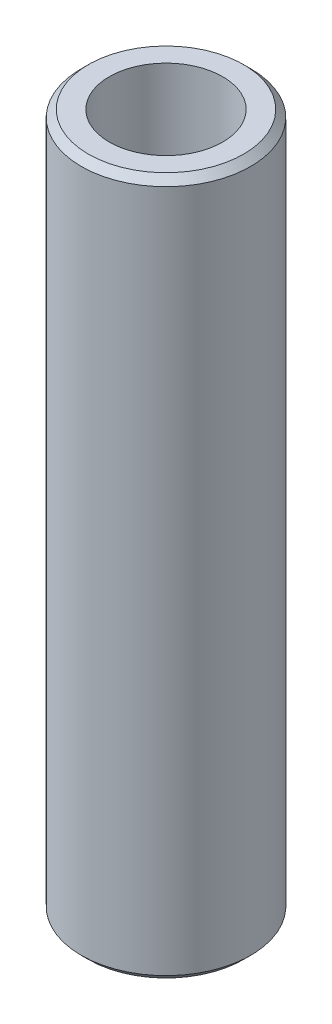
from build123d import *

# Parameters (mm, degrees)
SKETCH1_R           = 52.5
BOSS_EXTRUDE1_DEPTH = 432.197386778
SKETCH2_R           = 35.137357127
CUT_EXTRUDE1_DEPTH  = 439.528312812
CHAMFER1_SIZE       = 4.400283429


with BuildPart() as part:
    # Sketch1 → Boss-Extrude1 (new body)
    with BuildSketch(Plane(origin=(0, 0, 0), x_dir=(1, 0, 0), z_dir=(0, 1, 0))):
        Circle(SKETCH1_R)
    extrude(amount=BOSS_EXTRUDE1_DEPTH)

    # Sketch2 → Cut-Extrude1 (cut, through all)
    with BuildSketch(Plane(origin=(0, 0, 0), x_dir=(1, 0, 0), z_dir=(0, 1, 0))):
        Circle(SKETCH2_R)
    extrude(amount=CUT_EXTRUDE1_DEPTH, mode=Mode.SUBTRACT)

    # Chamfer1
    chamfer1_edges = [part.edges().sort_by_distance(p)[0] for p in [
        (-52.5, 432.197386778, 0),
        (-52.5, 0, 0),
    ]]
    chamfer(chamfer1_edges, length=CHAMFER1_SIZE)


solid = part.part
